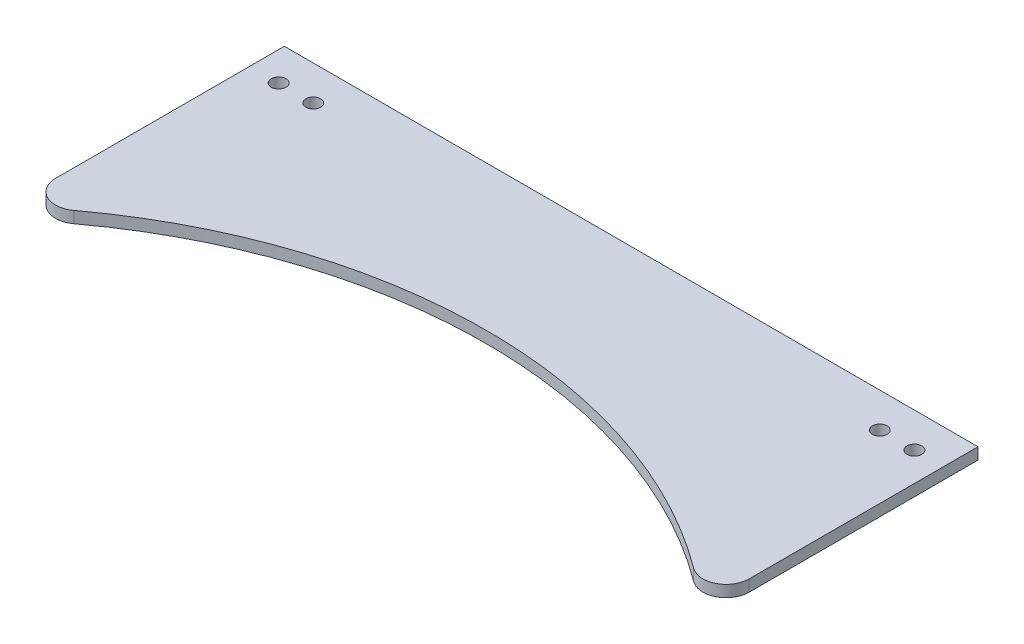
from build123d import *

# Parameters (mm, degrees)
BOSS_EXTRUDE1_DEPTH = 3.175
SKETCH3_R           = 2.032
CUT_EXTRUDE1_DEPTH  = 206.199343627
FILLET1_R           = 6.35


with BuildPart() as part:
    # Sketch1 → Boss-Extrude1 (new body)
    with BuildSketch(Plane(origin=(0, 0, 0), x_dir=(1, 0, 0), z_dir=(0, 1, 0))):
        with BuildLine():
            Line((0, 0), (0, 76.2))
            Line((0, 76.2), (190.5, 76.2))
            Line((190.5, 76.2), (190.5, 0))
            ThreePointArc((190.5, 0), (95.25, 36.382262572), (0, 0))
        make_face()
    extrude(amount=BOSS_EXTRUDE1_DEPTH)

    # Sketch3 → Cut-Extrude1 (cut, through all)
    with BuildSketch(Plane.XZ):
        with Locations((17.4625, -66.675)):
            Circle(SKETCH3_R)
        with Locations((7.9375, -66.675)):
            Circle(SKETCH3_R)
        with Locations((182.5625, -66.675)):
            Circle(SKETCH3_R)
        with Locations((173.0375, -66.675)):
            Circle(SKETCH3_R)
    extrude(amount=-CUT_EXTRUDE1_DEPTH, mode=Mode.SUBTRACT)

    # Fillet1
    fillet1_edges = [part.edges().sort_by_distance(p)[0] for p in [
        (0, 1.5875, 0),
        (190.5, 1.5875, 0),
    ]]
    fillet(fillet1_edges, radius=FILLET1_R)


solid = part.part
